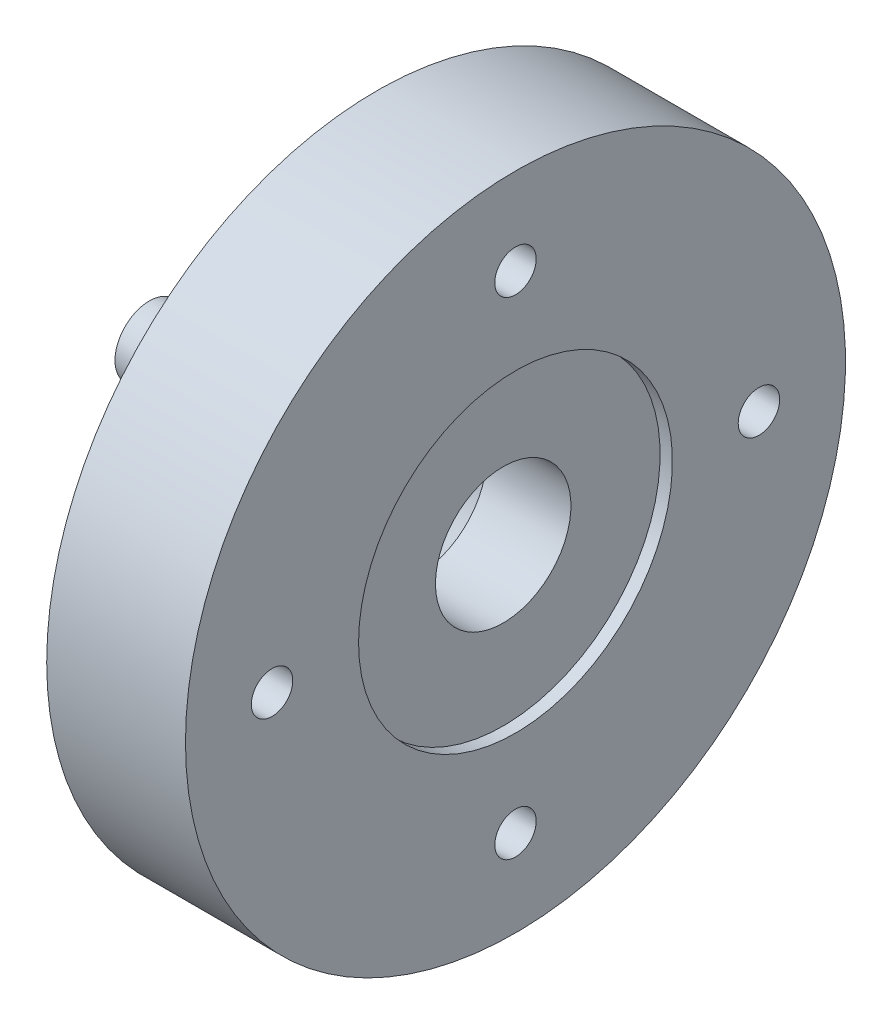
from build123d import *

# Parameters (mm, degrees)
CBORE_FOR_M3_HEX_SOCKET_HEAD_CAP_SCR_2_COUNT = 2
CBORE_FOR_M3_HEX_SOCKET_HEAD_CAP_SCR_2_PITCH = 28.243387552
CBORE_FOR_M3_HEX_SOCKET_HEAD_CAP_SCR_3_COUNT = 2
CBORE_FOR_M3_HEX_SOCKET_HEAD_CAP_SCR_3_PITCH = 39.942181723
CBORE_FOR_M3_HEX_SOCKET_HEAD_CAP_SCR_4_COUNT = 2
CBORE_FOR_M3_HEX_SOCKET_HEAD_CAP_SCR_4_PITCH = 28.243387552


with BuildPart() as part:
    # Sketch1 → Revolve17 (revolve)
    with BuildSketch(Plane.XY):
        Polygon((-71.291859268, 14.884170222), (-71.291859268, 14.534170222), (-66.841859268, 14.884170222), (-66.841859268, 14.534170222), (-62.371609448, 14.884170222), (-62.371609448, 14.534170222), (-59.488918076, 23.788045652), (-57.091214807, 23.788045652), (-57.091214807, 38.788045652), (-45.705811648, 38.788045652), (-45.705811648, 24.589170222), (-46.715811648, 24.589170222), (-46.715811648, 17.270420222), (-53.637545484, 17.270420222), (-59.488918076, 13.399170222), (-75.741859268, 13.399170222), (-75.741859268, 14.534170222), align=None)
    revolve(axis=Axis((-795.163849313, 11.714170222, 0), (1, 0, 0)))

    # Sketch4 → CBORE for M3 Hex Socket Head Cap Screw1 (revolve, cut)
    with BuildSketch(Plane(origin=(-57.091214807, 11.714170222, -19.971090862), x_dir=(0, 0, 1), z_dir=(0, 1, 0))):
        Polygon((0, 0), (0, 11.385403159), (1.7, 11.385403159), (1.7, 3.4), (1.675, 3.4), (1.675, 0.025), (1.7, 0), align=None)
    cbore_for_m3_hex_socket_head_cap_screw1 = revolve(axis=Axis((-63.441214807, 11.714170222, -19.971090862), (1, 0, 0)), mode=Mode.SUBTRACT)

    # CBORE for M3 Hex Socket Head Cap Scr 2: CBORE for M3 Hex Socket Head Cap Screw1 ×2
    with Locations(*[Vector(0, 0.7071067811865475, 0.7071067811865476) * (i * CBORE_FOR_M3_HEX_SOCKET_HEAD_CAP_SCR_2_PITCH) for i in range(1, CBORE_FOR_M3_HEX_SOCKET_HEAD_CAP_SCR_2_COUNT)]):
        add(cbore_for_m3_hex_socket_head_cap_screw1, mode=Mode.SUBTRACT)

    # CBORE for M3 Hex Socket Head Cap Scr 3: CBORE for M3 Hex Socket Head Cap Screw1 ×2
    with Locations(*[(0, 0, i * CBORE_FOR_M3_HEX_SOCKET_HEAD_CAP_SCR_3_PITCH) for i in range(1, CBORE_FOR_M3_HEX_SOCKET_HEAD_CAP_SCR_3_COUNT)]):
        add(cbore_for_m3_hex_socket_head_cap_screw1, mode=Mode.SUBTRACT)

    # CBORE for M3 Hex Socket Head Cap Scr 4: CBORE for M3 Hex Socket Head Cap Screw1 ×2
    with Locations(*[Vector(0, -0.7071067811865476, 0.7071067811865475) * (i * CBORE_FOR_M3_HEX_SOCKET_HEAD_CAP_SCR_4_PITCH) for i in range(1, CBORE_FOR_M3_HEX_SOCKET_HEAD_CAP_SCR_4_COUNT)]):
        add(cbore_for_m3_hex_socket_head_cap_screw1, mode=Mode.SUBTRACT)


solid = part.part
